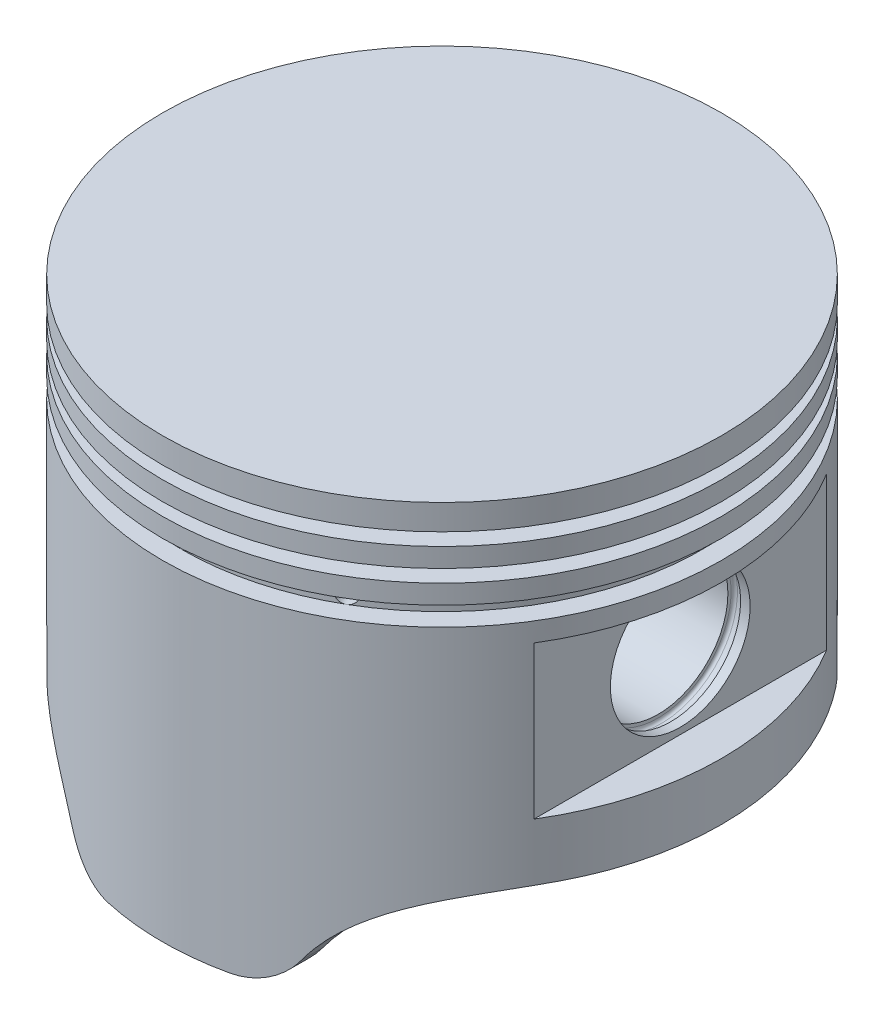
from build123d import *

# Parameters (mm, degrees)
CUT_EXTRUDE1_DEPTH      = 93.913938674
CUT_EXTRUDE1_DEPTH_BACK = 93.913938674
SKETCH2_W               = 13
SKETCH2_H               = 24
BOSS_EXTRUDE1_DEPTH     = 39
BOSS_EXTRUDE2_DEPTH     = 10
CUT_EXTRUDE2_DEPTH      = 116.495670915
CUT_EXTRUDE2_DEPTH_BACK = 116.495670915
SKETCH7_R               = 11
FILLET1_R               = 2
CUT_EXTRUDE3_DEPTH      = 93.913938674
CUT_EXTRUDE3_DEPTH_BACK = 93.913938674
FILLET2_R               = 10
SKETCH10_W              = 3
SKETCH10_H              = 3
SKETCH11_R              = 1.5
CUT_EXTRUDE4_DEPTH      = 93.913938769
CIRPATTERN3_COUNT       = 12


# Read off the part's stored shape, not the designer's step: Revolve1
with BuildPart() as part:
    # Revolve1 outline → Revolve1 (revolve)
    with BuildSketch(Plane.XY):
        Polygon((0, 69), (0, 59), (36, 59), (36, 20), (41, 20), (41, 0), (44, 0), (44, 58), (41, 58), (41, 60), (44, 60), (44, 63), (41, 63), (41, 65), (44, 65), (44, 69), align=None)
    revolve(axis=Axis((0, 0, 0), (0, 1, 0)))

    # Sketch2 → Cut-Extrude1 (cut, two sides: drawn at the far end of the back side and taken through both)
    with BuildSketch(Plane.XY.offset(-CUT_EXTRUDE1_DEPTH_BACK)):
        with Locations((44, 37)):
            Rectangle(SKETCH2_W, SKETCH2_H)
        with Locations((-44, 37)):
            Rectangle(SKETCH2_W, SKETCH2_H)
    extrude(amount=CUT_EXTRUDE1_DEPTH + CUT_EXTRUDE1_DEPTH_BACK, mode=Mode.SUBTRACT)

    # Sketch5 → Boss-Extrude1 (add)
    with BuildSketch(Plane.XZ.offset(-20)):
        with BuildLine():
            Line((-30, -19.899748742), (-30, 19.899748742))
            ThreePointArc((-30, 19.899748742), (-36, 0), (-30, -19.899748742))
        make_face()
        with BuildLine():
            Line((30, 19.899748742), (30, -19.899748742))
            ThreePointArc((30, -19.899748742), (36, 0), (30, 19.899748742))
        make_face()
    extrude(amount=-BOSS_EXTRUDE1_DEPTH)

    # Sketch6 → Boss-Extrude2 (add)
    with BuildSketch(Plane(origin=(-30, 0, 0), x_dir=(0, 0, -1), z_dir=(1, 0, 0))):
        with BuildLine():
            Line((-15, 37), (-15, 59))
            Line((-15, 59), (15, 59))
            Line((15, 59), (15, 37))
            ThreePointArc((15, 37), (0, 22), (-15, 37))
        make_face()
    boss_extrude2 = extrude(amount=BOSS_EXTRUDE2_DEPTH)

    # Mirror1: Boss-Extrude2 across plane
    add(boss_extrude2.mirror(Plane(origin=(0, 0, 0), x_dir=(0, 0, 1), z_dir=(1, 0, 0))))

    # Sketch7 → Cut-Extrude2 (cut, two sides: drawn at the far end of the back side and taken through both)
    with BuildSketch(Plane(origin=(37.5, 0, 0), x_dir=(0, 0, -1), z_dir=(1, 0, 0)).offset(-CUT_EXTRUDE2_DEPTH_BACK)):
        with Locations((0, 37)):
            Circle(SKETCH7_R)
    extrude(amount=CUT_EXTRUDE2_DEPTH + CUT_EXTRUDE2_DEPTH_BACK, mode=Mode.SUBTRACT)

    # Fillet1
    fillet1_edges = [part.edges().sort_by_distance(p)[0] for p in [
        (20, 22, 0),
        (20, 48, 15),
        (20, 48, -15),
        (-20, 22, 0),
        (-20, 48, -15),
        (-20, 48, 15),
    ]]
    fillet(fillet1_edges, radius=FILLET1_R)

    # Sketch8 → Cut-Extrude3 (cut, two sides: drawn at the far end of the back side and taken through both)
    with BuildSketch(Plane.XY.offset(-CUT_EXTRUDE3_DEPTH_BACK)):
        with BuildLine():
            Line((-44, 16), (-39, 16))
            ThreePointArc((-39, 16), (-24.857864376, 11.615528128), (-15.676192421, 0))
            Line((-15.676192421, 0), (-44, 0))
            Line((-44, 0), (-44, 16))
        make_face()
        with BuildLine():
            Line((44, 0), (44, 16))
            Line((44, 16), (39, 16))
            ThreePointArc((39, 16), (24.857864376, 11.615528128), (15.676192421, 0))
            Line((15.676192421, 0), (44, 0))
        make_face()
    extrude(amount=CUT_EXTRUDE3_DEPTH + CUT_EXTRUDE3_DEPTH_BACK, mode=Mode.SUBTRACT)

    # Fillet2
    fillet2_edges = [part.edges().sort_by_distance(p)[0] for p in [
        (15.676192421, 0, 39.498760447),
        (15.676192421, 0, -39.498760447),
        (-15.676192421, 0, -39.498760447),
        (-15.676192421, 0, 39.498760447),
    ]]
    fillet(fillet2_edges, radius=FILLET2_R)

    # Sketch9 → Cut-Revolve1 (revolve, cut)
    with BuildSketch(Plane.XY, mode=Mode.PRIVATE) as cut_revolve1_sk:
        with BuildLine():
            Line((34.5, 49), (35.5, 49))
            ThreePointArc((35.5, 49), (35.853553391, 48.853553391), (36, 48.5))
            Line((36, 48.5), (36, 47.5))
            ThreePointArc((36, 47.5), (35.853553391, 47.146446609), (35.5, 47))
            Line((35.5, 47), (34.5, 47))
            ThreePointArc((34.5, 47), (34.146446609, 47.146446609), (34, 47.5))
            Line((34, 47.5), (34, 48.5))
            ThreePointArc((34, 48.5), (34.146446609, 48.853553391), (34.5, 49))
        make_face()
        with BuildLine():
            Line((-36, 48.5), (-36, 47.5))
            ThreePointArc((-36, 47.5), (-35.853553391, 47.146446609), (-35.5, 47))
            Line((-35.5, 47), (-34.5, 47))
            ThreePointArc((-34.5, 47), (-34.146446609, 47.146446609), (-34, 47.5))
            Line((-34, 47.5), (-34, 48.5))
            ThreePointArc((-34, 48.5), (-34.146446609, 48.853553391), (-34.5, 49))
            Line((-34.5, 49), (-35.5, 49))
            ThreePointArc((-35.5, 49), (-35.853553391, 48.853553391), (-36, 48.5))
        make_face()
    revolve(cut_revolve1_sk.sketch.rotate(Axis((-37.5, 37, 0), (1, 0, 0)), 90), axis=Axis((-37.5, 37, 0), (1, 0, 0)), mode=Mode.SUBTRACT)

    # Sketch10 → Cut-Revolve2 (revolve, cut)
    with BuildSketch(Plane.XY, mode=Mode.PRIVATE) as cut_revolve2_sk:
        with Locations((42.5, 53.5)):
            Rectangle(SKETCH10_W, SKETCH10_H)
    revolve(cut_revolve2_sk.sketch.rotate(Axis((0, 0, 0), (0, 1, 0)), 90), axis=Axis((0, 0, 0), (0, 1, 0)), mode=Mode.SUBTRACT)

    # Sketch11 → Cut-Extrude4 (cut, through all)
    with BuildSketch(Plane.XY):
        with Locations((0, 53.5)):
            Circle(SKETCH11_R)
    cut_extrude4 = extrude(amount=-CUT_EXTRUDE4_DEPTH, mode=Mode.SUBTRACT)

    # CirPattern3: Cut-Extrude4 ×12 about axis, 6 skipped
    cirpattern3_axis = Axis((0, 69, 0), (0, -1, 0))
    add([cut_extrude4.rotate(cirpattern3_axis, i * 360 / CIRPATTERN3_COUNT) for i in range(1, CIRPATTERN3_COUNT) if i not in (2, 3, 4, 8, 9, 10)], mode=Mode.SUBTRACT)


solid = part.part
